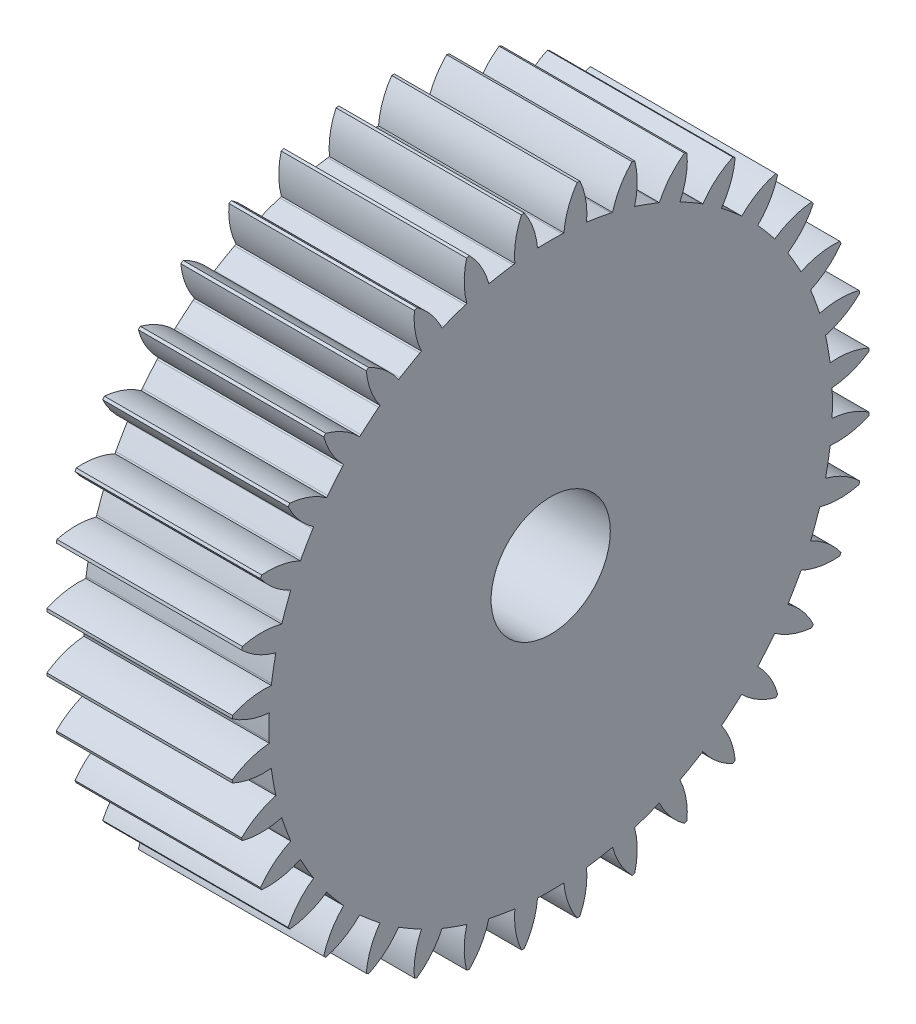
from build123d import *

# Parameters (mm, degrees)
SKETCH1_R                = 120.65
BOSS_EXTRUDE1_DEPTH      = 35
SKETCH6_R                = 22.5
CUT_EXTRUDE4_DEPTH       = 185.425716753
CUT_EXTRUDE5_DEPTH       = 185.425716753
FILLET1_R                = 160
CIRPATTERN1_COUNT        = 36
FILLET1_OF_CIRPATTERN1_R = 160


with BuildPart() as part:
    # Sketch1 → Boss-Extrude1 (new, symmetric)
    with BuildSketch(Plane(origin=(0, 0, 0), x_dir=(0, 0, -1), z_dir=(1, 0, 0))):
        Circle(SKETCH1_R)
    extrude(amount=BOSS_EXTRUDE1_DEPTH, both=True)

    # Sketch6 → Cut-Extrude4 (cut, through all)
    with BuildSketch(Plane(origin=(35, 0, 0), x_dir=(0, 0, -1), z_dir=(1, 0, 0))):
        Circle(SKETCH6_R)
    extrude(amount=-CUT_EXTRUDE4_DEPTH, mode=Mode.SUBTRACT)

    # Sketch7 → Cut-Extrude5 (cut, through all)
    with BuildSketch(Plane(origin=(35, 0, 0), x_dir=(0, 0, -1), z_dir=(1, 0, 0))):
        with BuildLine():
            Line((0, 106.383728496), (-4.985, 106.248119983))
            ThreePointArc((-4.985, 106.248119983), (-6.567583943, 113.568001322), (-9.975, 120.236940559))
            Line((-9.975, 120.236940559), (0, 134.344965806))
            Line((0, 134.344965806), (9.975, 120.236940559))
            ThreePointArc((9.975, 120.236940559), (6.567583943, 113.568001322), (4.985, 106.248119983))
            Line((4.985, 106.248119983), (0, 106.383728496))
        make_face()
    cut_extrude5 = extrude(amount=-CUT_EXTRUDE5_DEPTH, mode=Mode.SUBTRACT)

    # Fillet1
    # the kernel refuses this fillet: 160 mm, written as the material it takes off along each edge
    with BuildSketch(Plane(origin=(45.88132498, 106.383728496, 0), x_dir=(0, -0.027193252533538107, -0.9996301951305028), z_dir=(-1, 0, 0))) as fillet1_piece_1:
        with BuildLine():
            CenterArc((FILLET1_R * 0.0272033124509, FILLET1_R), FILLET1_R, 266.883498622, 3.116501378)
            Line((-FILLET1_R * 0.0271630802217, FILLET1_R * 0.00147894596671), (0, 0))
            Line((0, 0), (FILLET1_R * 0.0272033124509, 0))
        make_face()
    extrude(amount=91.762649961, mode=Mode.SUBTRACT)

    # CirPattern1: Cut-Extrude5 ×36 about axis
    cirpattern1_axis = Axis((0, 0, 0), (1, 0, 0))
    for i in range(1, CIRPATTERN1_COUNT):
        add(cut_extrude5.rotate(cirpattern1_axis, i * 360 / CIRPATTERN1_COUNT), mode=Mode.SUBTRACT)

    # Fillet1 of CirPattern1
    # the kernel refuses this fillet: 160 mm, written as the material it takes off along each edge
    with BuildSketch(Plane(origin=(45.88132498, 104.767520617, 18.473340587), x_dir=(0, -0.20036408764989777, 0.97972150756234), z_dir=(-1, 0, 0)), Plane(origin=(45.88132498, 99.968004639, 36.385378068), x_dir=(0, -0.3674469613521374, 0.9300444777498982), z_dir=(-1, 0, 0)), Plane(origin=(45.88132498, 92.131011427, 53.191864248), x_dir=(0, -0.5233651450708215, 0.8521085171062416), z_dir=(-1, 0, 0)), Plane(origin=(45.88132498, 81.494664053, 68.382142549), x_dir=(0, -0.6633811436920738, 0.7482816703580252), z_dir=(-1, 0, 0)), Plane(origin=(45.88132498, 68.382142549, 81.494664053), x_dir=(0, -0.7832406419492975, 0.6217186637047761), z_dir=(-1, 0, 0)), Plane(origin=(45.88132498, 53.191864248, 92.131011427), x_dir=(0, -0.8793017696397809, 0.4762650500596803), z_dir=(-1, 0, 0)), Plane(origin=(45.88132498, 36.385378068, 99.968004639), x_dir=(0, -0.948645758007923, 0.31634036387026737), z_dir=(-1, 0, 0)), Plane(origin=(45.88132498, 18.473340587, 104.767520617), x_dir=(0, -0.989165625056911, 0.14680383580060324), z_dir=(-1, 0, 0)), Plane(origin=(45.88132498, 0, 106.383728496), x_dir=(0, -0.9996301951305028, -0.02719325253353811), z_dir=(-1, 0, 0)), Plane(origin=(45.88132498, -18.473340587, 104.767520617), x_dir=(0, -0.9797215075623386, -0.2003640876499045), z_dir=(-1, 0, 0)), Plane(origin=(45.88132498, -36.385378068, 99.968004639), x_dir=(0, -0.9300444777498993, -0.36744696135213456), z_dir=(-1, 0, 0)), Plane(origin=(45.88132498, -53.191864248, 92.131011427), x_dir=(0, -0.8521085171062416, -0.5233651450708215), z_dir=(-1, 0, 0)), Plane(origin=(45.88132498, -68.382142549, 81.494664053), x_dir=(0, -0.7482816703580252, -0.6633811436920738), z_dir=(-1, 0, 0)), Plane(origin=(45.88132498, -81.494664053, 68.382142549), x_dir=(0, -0.621718663704776, -0.7832406419492974), z_dir=(-1, 0, 0)), Plane(origin=(45.88132498, -92.131011427, 53.191864248), x_dir=(0, -0.4762650500596803, -0.8793017696397809), z_dir=(-1, 0, 0)), Plane(origin=(45.88132498, -99.968004639, 36.385378068), x_dir=(0, -0.31634036387026054, -0.9486457580079253), z_dir=(-1, 0, 0)), Plane(origin=(45.88132498, -104.767520617, 18.473340587), x_dir=(0, -0.14680383580060338, -0.989165625056911), z_dir=(-1, 0, 0)), Plane(origin=(45.88132498, -106.383728496, 0), x_dir=(0, 0.027193252533541372, -0.9996301951305028), z_dir=(-1, 0, 0)), Plane(origin=(45.88132498, -104.767520617, -18.473340587), x_dir=(0, 0.2003640876499045, -0.9797215075623386), z_dir=(-1, 0, 0)), Plane(origin=(45.88132498, -99.968004639, -36.385378068), x_dir=(0, 0.36744696135213345, -0.9300444777498997), z_dir=(-1, 0, 0)), Plane(origin=(45.88132498, -92.131011427, -53.191864248), x_dir=(0, 0.5233651450708215, -0.8521085171062416), z_dir=(-1, 0, 0)), Plane(origin=(45.88132498, -81.494664053, -68.382142549), x_dir=(0, 0.6633811436920771, -0.7482816703580221), z_dir=(-1, 0, 0)), Plane(origin=(45.88132498, -68.382142549, -81.494664053), x_dir=(0, 0.7832406419493003, -0.6217186637047725), z_dir=(-1, 0, 0)), Plane(origin=(45.88132498, -53.191864248, -92.131011427), x_dir=(0, 0.879301769639784, -0.4762650500596745), z_dir=(-1, 0, 0)), Plane(origin=(45.88132498, -36.385378068, -99.968004639), x_dir=(0, 0.948645758007923, -0.31634036387026737), z_dir=(-1, 0, 0)), Plane(origin=(45.88132498, -18.473340587, -104.767520617), x_dir=(0, 0.989165625056911, -0.14680383580060324), z_dir=(-1, 0, 0)), Plane(origin=(45.88132498, 0, -106.383728496), x_dir=(0, 0.9996301951305028, 0.027193252533538107), z_dir=(-1, 0, 0)), Plane(origin=(45.88132498, 18.473340587, -104.767520617), x_dir=(0, 0.97972150756234, 0.2003640876498981), z_dir=(-1, 0, 0)), Plane(origin=(45.88132498, 36.385378068, -99.968004639), x_dir=(0, 0.9300444777498996, 0.367446961352134), z_dir=(-1, 0, 0)), Plane(origin=(45.88132498, 53.191864248, -92.131011427), x_dir=(0, 0.8521085171062416, 0.5233651450708215), z_dir=(-1, 0, 0)), Plane(origin=(45.88132498, 68.382142549, -81.494664053), x_dir=(0, 0.7482816703580206, 0.6633811436920788), z_dir=(-1, 0, 0)), Plane(origin=(45.88132498, 81.494664053, -68.382142549), x_dir=(0, 0.621718663704776, 0.7832406419492974), z_dir=(-1, 0, 0)), Plane(origin=(45.88132498, 92.131011427, -53.191864248), x_dir=(0, 0.47626505005968095, 0.8793017696397806), z_dir=(-1, 0, 0)), Plane(origin=(45.88132498, 99.968004639, -36.385378068), x_dir=(0, 0.3163403638702576, 0.9486457580079263), z_dir=(-1, 0, 0)), Plane(origin=(45.88132498, 104.767520617, -18.473340587), x_dir=(0, 0.14680383580060324, 0.989165625056911), z_dir=(-1, 0, 0))) as fillet1_of_cirpattern1_piece_1:
        with BuildLine():
            CenterArc((FILLET1_OF_CIRPATTERN1_R * 0.0272033124509, -FILLET1_OF_CIRPATTERN1_R), FILLET1_OF_CIRPATTERN1_R, 90, 3.116501378)
            Line((-FILLET1_OF_CIRPATTERN1_R * 0.0271630802217, -FILLET1_OF_CIRPATTERN1_R * 0.00147894596671), (0, 0))
            Line((0, 0), (FILLET1_OF_CIRPATTERN1_R * 0.0272033124509, 0))
        make_face()
    extrude(amount=91.762649961, mode=Mode.SUBTRACT)


solid = part.part
